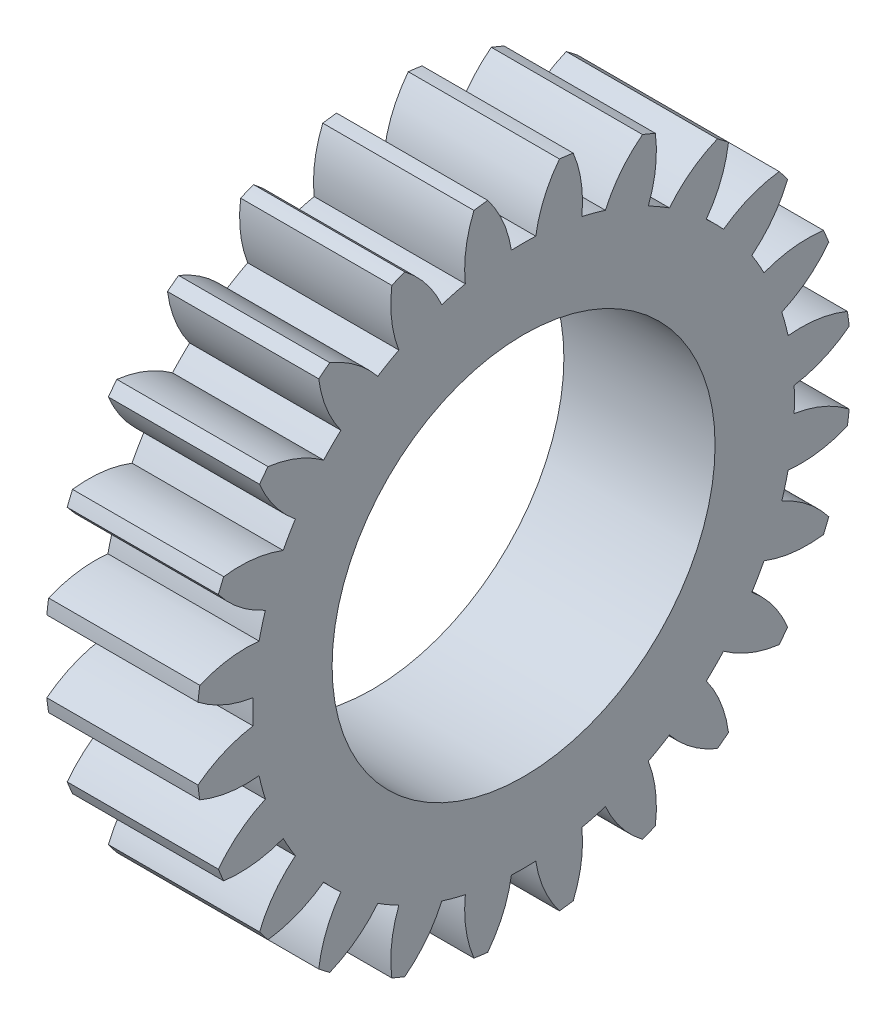
from build123d import *

# Parameters (mm, degrees)
BASPROSKE_W     = 6
BASPROSKE_H     = 13
TOOTHCUT_DEPTH  = 20.339079606
TEETHCUTS_COUNT = 24
TEETHCUTS_ANGLE = 345
BORSKE_R        = 7.6
BORE_DEPTH      = 50.0000508


with BuildPart() as part:
    # BasProSke → Base-Revolve (revolve)
    with BuildSketch(Plane(origin=(0, 0, 0), x_dir=(1, 0, 0), z_dir=(0, 1, 0))):
        with Locations((3, 6.5)):
            Rectangle(BASPROSKE_W, BASPROSKE_H)
    revolve(axis=Axis((-10, 0, 0), (1, 0, 0)))

    # TooCutSke → ToothCut (cut, through all)
    with BuildSketch(Plane(origin=(0, 0, 0), x_dir=(0, 0, -1), z_dir=(1, 0, 0))):
        with BuildLine():
            ThreePointArc((0.483448384, 10.738122679), (0, 10.749), (-0.483448384, 10.738122679))
            ThreePointArc((-0.483448384, 10.738122679), (-0.821636462, 11.902754369), (-1.44092227, 12.945454344))
            ThreePointArc((-1.44092227, 12.945454344), (0, 13.0254), (1.44092227, 12.945454344))
            ThreePointArc((1.44092227, 12.945454344), (0.821636462, 11.902754369), (0.483448384, 10.738122679))
        make_face()
    toothcut = extrude(amount=TOOTHCUT_DEPTH, mode=Mode.SUBTRACT)

    # TeethCuts: ToothCut ×24 about axis
    teethcuts_axis = Axis((-10, 0, 0), (1, 0, 0))
    for i in range(1, TEETHCUTS_COUNT):
        add(toothcut.rotate(teethcuts_axis, i * TEETHCUTS_ANGLE / (TEETHCUTS_COUNT - 1)), mode=Mode.SUBTRACT)

    # BorSke → Bore (cut, symmetric)
    with BuildSketch(Plane(origin=(0, 0, 0), x_dir=(0, 0, -1), z_dir=(1, 0, 0))):
        Circle(BORSKE_R)
    extrude(amount=BORE_DEPTH, both=True, mode=Mode.SUBTRACT)


solid = part.part
